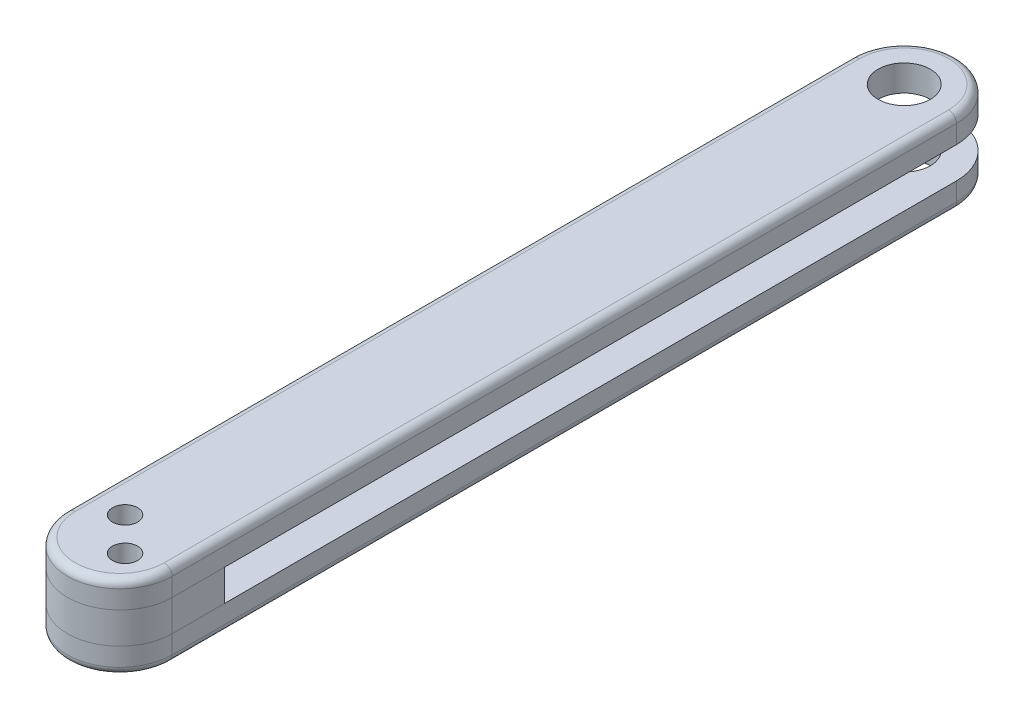
from build123d import *

# Parameters (mm, degrees)
SKETCH1_R                                       = 2.5
BOSS_EXTRUDE1_DEPTH                             = 4
CUT_EXTRUDE1_START                              = -42.5
SKETCH2_W                                       = 10
SKETCH2_H                                       = 3
CUT_EXTRUDE1_DEPTH                              = 75
CSK_FOR_M2_FLAT_HEAD_MACHINE_SCREW1_D           = 2.4
CSK_FOR_M2_FLAT_HEAD_MACHINE_SCREW1_CSINK_D     = 4.4
CSK_FOR_M2_FLAT_HEAD_MACHINE_SCREW1_CSINK_ANGLE = 90
CUT_EXTRUDE2_DEPTH                              = 2
FILLET1_R                                       = 0.75
SPLIT1_START                                    = -1.5
SPLIT1_OUTLINE_R                                = 1.2
SPLIT1_DEPTH                                    = 3
SPLIT1_2_OUTLINE_R                              = 2.5
SPLIT1_2_OUTLINE_R_2                            = 1.2
SPLIT1_2_DEPTH                                  = 5.5
SPLIT1_START_2                                  = 1.5
SPLIT1_3_OUTLINE_R                              = 1.2
SPLIT1_3_OUTLINE_R_2                            = 2.5
SPLIT1_3_DEPTH                                  = 2.5
SPLIT1_START_3                                  = -42.5000001
SPLIT1_4_DEPTH                                  = 85.0000001
SPLIT1_5_ANGLE                                  = 180
SPLIT1_6_ANGLE                                  = 180


with BuildPart() as part:
    # Sketch1 → Boss-Extrude1 (new, symmetric)
    with BuildSketch(Plane(origin=(0, 0, 0), x_dir=(1, 0, 0), z_dir=(0, 1, 0))):
        with BuildLine():
            Line((5, 37.5), (5, -37.5))
            ThreePointArc((5, -37.5), (0, -42.5), (-5, -37.5))
            Line((-5, -37.5), (-5, 37.5))
            ThreePointArc((-5, 37.5), (0, 42.5), (5, 37.5))
        make_face()
        with Locations(Location((0, 37.5, 0), (0, 0, 270))):
            Circle(SKETCH1_R, mode=Mode.SUBTRACT)
    extrude(amount=BOSS_EXTRUDE1_DEPTH, both=True)

    # Sketch2 → Cut-Extrude1 (cut)
    with BuildSketch(Plane.XY.offset(CUT_EXTRUDE1_START)):
        Rectangle(SKETCH2_W, SKETCH2_H)
    extrude(amount=CUT_EXTRUDE1_DEPTH, mode=Mode.SUBTRACT)

    # CSK for M2 Flat Head Machine Screw1 (through all)
    with Locations(Plane.XZ.offset(4)):
        with Locations((-1.590990258, 35.409009742), (1.590990258, 38.590990258)):
            CounterSinkHole(CSK_FOR_M2_FLAT_HEAD_MACHINE_SCREW1_D / 2, CSK_FOR_M2_FLAT_HEAD_MACHINE_SCREW1_CSINK_D / 2, counter_sink_angle=CSK_FOR_M2_FLAT_HEAD_MACHINE_SCREW1_CSINK_ANGLE)

    # Sketch7 → Cut-Extrude2 (cut)
    with BuildSketch(Plane(origin=(0, -4, 0), x_dir=(1, 0, 0), z_dir=(0, 1, 0))):
        with BuildLine():
            Line((-0.035355339, -33.853374824), (3.146625176, -37.035355339))
            ThreePointArc((3.146625176, -37.035355339), (3.146625176, -40.146625176), (0.035355339, -40.146625176))
            Line((0.035355339, -40.146625176), (-3.146625176, -36.964644661))
            ThreePointArc((-3.146625176, -36.964644661), (-3.146625176, -33.853374824), (-0.035355339, -33.853374824))
        make_face()
    extrude(amount=CUT_EXTRUDE2_DEPTH, mode=Mode.SUBTRACT)

    # Fillet1
    fillet1_edges = [part.edges().sort_by_distance(p)[0] for p in [
        (0, 4, 42.5),
        (5, 4, 0),
        (0, 4, -42.5),
        (5, -4, 0),
        (0, -4, 42.5),
        (-5, -4, 0),
        (0, -4, -42.5),
        (-5, 4, 0),
    ]]
    fillet(fillet1_edges, radius=FILLET1_R)

    # Split1 2 outline → Split1 2 (cut)
    with BuildSketch(Plane(origin=(0, 0, 0), x_dir=(1, 0, 0), z_dir=(0, 1, 0)).offset(SPLIT1_START)):
        with BuildLine():
            ThreePointArc((5, 37.5), (0, 42.5), (-5, 37.5))
            Line((-5, 37.5), (-5, -37.5))
            ThreePointArc((-5, -37.5), (0, -42.5), (5, -37.5))
            Line((5, -37.5), (5, 37.5))
        make_face()
        with Locations((0, 37.5)):
            Circle(SPLIT1_2_OUTLINE_R, mode=Mode.SUBTRACT)
        with Locations((1.590990258, -38.590990258)):
            Circle(SPLIT1_2_OUTLINE_R_2, mode=Mode.SUBTRACT)
        with Locations((-1.590990258, -35.409009742)):
            Circle(SPLIT1_2_OUTLINE_R_2, mode=Mode.SUBTRACT)
    extrude(amount=SPLIT1_2_DEPTH, mode=Mode.SUBTRACT)


with BuildPart() as body_2:
    # Split1: read off the stored shape, not the designer's step
    # Split1 outline → Split1 (new body)
    with BuildSketch(Plane(origin=(0, 0, 0), x_dir=(1, 0, 0), z_dir=(0, 1, 0)).offset(SPLIT1_START)):
        with BuildLine():
            Line((5, -32.5), (-5, -32.5))
            Line((-5, -32.5), (-5, -37.5))
            ThreePointArc((-5, -37.5), (0, -42.5), (5, -37.5))
            Line((5, -37.5), (5, -32.5))
        make_face()
        with Locations((1.590990258, -38.590990258)):
            Circle(SPLIT1_OUTLINE_R, mode=Mode.SUBTRACT)
        with Locations((-1.590990258, -35.409009742)):
            Circle(SPLIT1_OUTLINE_R, mode=Mode.SUBTRACT)
    extrude(amount=SPLIT1_DEPTH)


with BuildPart() as body_3:
    # Split1 3 outline → Split1 3 (new body)
    with BuildSketch(Plane(origin=(0, 0, 0), x_dir=(1, 0, 0), z_dir=(0, 1, 0)).offset(SPLIT1_START_2)):
        with BuildLine():
            ThreePointArc((5, 37.5), (0, 42.5), (-5, 37.5))
            Line((-5, 37.5), (-5, -37.5))
            ThreePointArc((-5, -37.5), (0, -42.5), (5, -37.5))
            Line((5, -37.5), (5, 37.5))
        make_face()
        with Locations((-1.590990258, -35.409009742)):
            Circle(SPLIT1_3_OUTLINE_R, mode=Mode.SUBTRACT)
        with Locations((1.590990258, -38.590990258)):
            Circle(SPLIT1_3_OUTLINE_R, mode=Mode.SUBTRACT)
        with Locations((0, 37.5)):
            Circle(SPLIT1_3_OUTLINE_R_2, mode=Mode.SUBTRACT)
    extrude(amount=SPLIT1_3_DEPTH)

    # Split1 4 outline → Split1 4 (cut)
    with BuildSketch(Plane.XY.offset(SPLIT1_START_3)):
        with BuildLine():
            ThreePointArc((-5, 3.25), (-4.780330086, 3.780330086), (-4.25, 4))
            Line((-4.25, 4), (-5, 4))
            Line((-5, 4), (-5, 3.25))
        make_face()
        with BuildLine():
            ThreePointArc((4.25, 4), (4.780330086, 3.780330086), (5, 3.25))
            Line((5, 3.25), (5, 4))
            Line((5, 4), (4.25, 4))
        make_face()
    extrude(amount=SPLIT1_4_DEPTH, mode=Mode.SUBTRACT)

    # Split1 5 outline → Split1 5 (revolve, cut)
    with BuildSketch(Plane(origin=(0, 0, 37.5), x_dir=(-1, 0, 0), z_dir=(0, 0, -1))):
        with BuildLine():
            ThreePointArc((4.25, 4), (4.780330086, 3.780330086), (5, 3.25))
            Line((5, 3.25), (5, 4))
            Line((5, 4), (4.25, 4))
        make_face()
    revolve(axis=Axis((0, 0, 37.5), (0, 1, 0)), revolution_arc=SPLIT1_5_ANGLE, mode=Mode.SUBTRACT)

    # Split1 6 outline → Split1 6 (revolve, cut)
    with BuildSketch(Plane.XY.offset(-37.5)):
        with BuildLine():
            ThreePointArc((4.25, 4), (4.780330086, 3.780330086), (5, 3.25))
            Line((5, 3.25), (5, 4))
            Line((5, 4), (4.25, 4))
        make_face()
    revolve(axis=Axis((0, 0, -37.5), (0, 1, 0)), revolution_arc=SPLIT1_6_ANGLE, mode=Mode.SUBTRACT)


solid = Compound([part.part, body_2.part, body_3.part])
